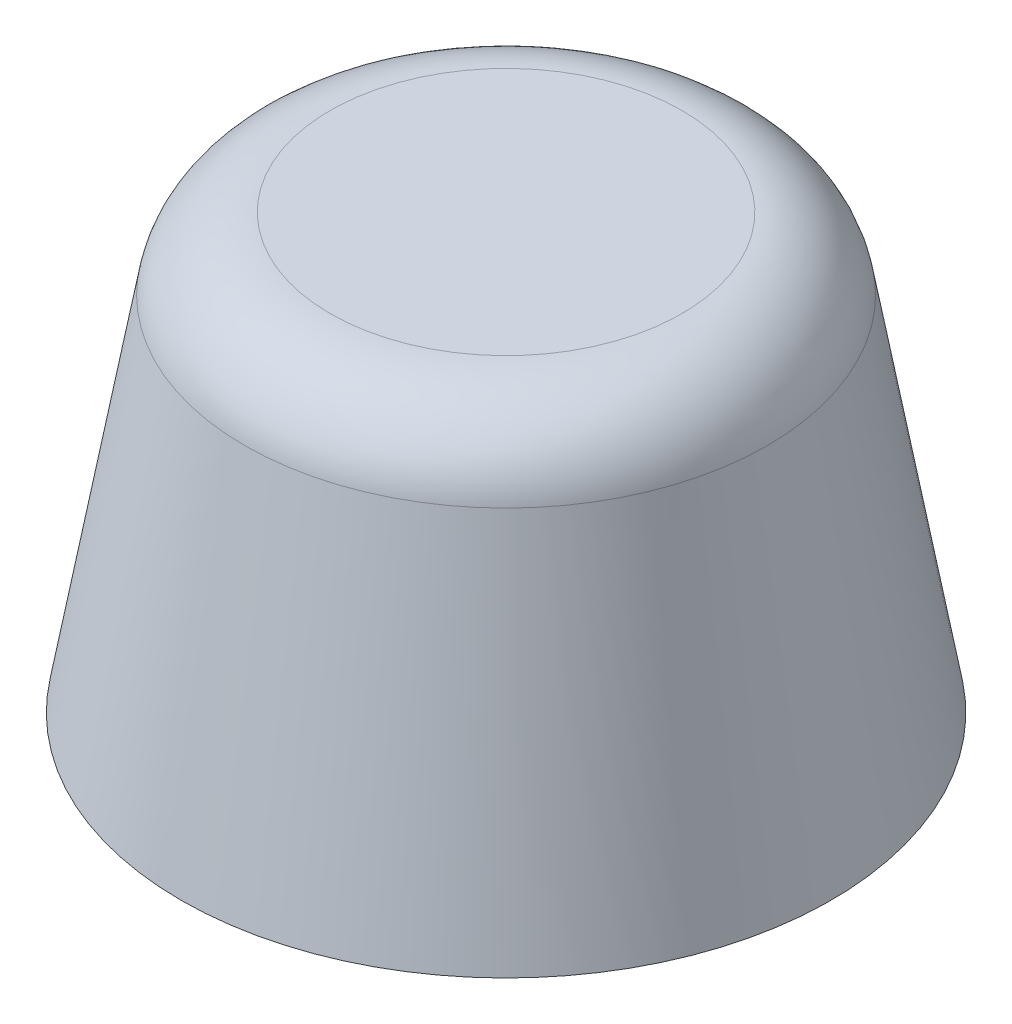
from build123d import *

# Parameters (mm, degrees)
SKETCH1_R           = 7.5
BOSS_EXTRUDE1_DEPTH = 10
BOSS_EXTRUDE1_TAPER = 10
SKETCH2_R           = 5.625
CUT_EXTRUDE1_DEPTH  = 2.25
FILLET1_R           = 2


# Read off the part's stored shape, not the designer's step: Shell2
with BuildPart() as part:
    # Sketch1 → Boss-Extrude1 (new body)
    with BuildSketch(Plane(origin=(0, 0, 0), x_dir=(1, 0, 0), z_dir=(0, 1, 0))):
        Circle(SKETCH1_R)
    extrude(amount=BOSS_EXTRUDE1_DEPTH, taper=BOSS_EXTRUDE1_TAPER)

    # Sketch2 → Cut-Extrude1 (cut)
    with BuildSketch(Plane.XZ):
        with Locations(Location((0, 0, 0), (0, 0, 270))):
            Circle(SKETCH2_R)
    extrude(amount=-CUT_EXTRUDE1_DEPTH, mode=Mode.SUBTRACT)

    # Fillet1
    fillet1_edges = [part.edges().sort_by_distance(p)[0] for p in [
        (-5.736730193, 10, 0),
    ]]
    fillet(fillet1_edges, radius=FILLET1_R)

    # Shell2 outline → Shell2 (revolve, cut)
    with BuildSketch(Plane.XY):
        with BuildLine():
            Line((5.580124376, 2.25), (4.550934807, 8.086824089))
            ThreePointArc((4.550934807, 8.086824089), (4.379924736, 8.383022222), (4.058530931, 8.5))
            Line((4.058530931, 8.5), (0, 8.5))
            Line((0, 8.5), (0, 2.25))
            Line((0, 2.25), (5.580124376, 2.25))
        make_face()
    revolve(axis=Axis((0, 0, 0), (0, 1, 0)), mode=Mode.SUBTRACT)


solid = part.part
